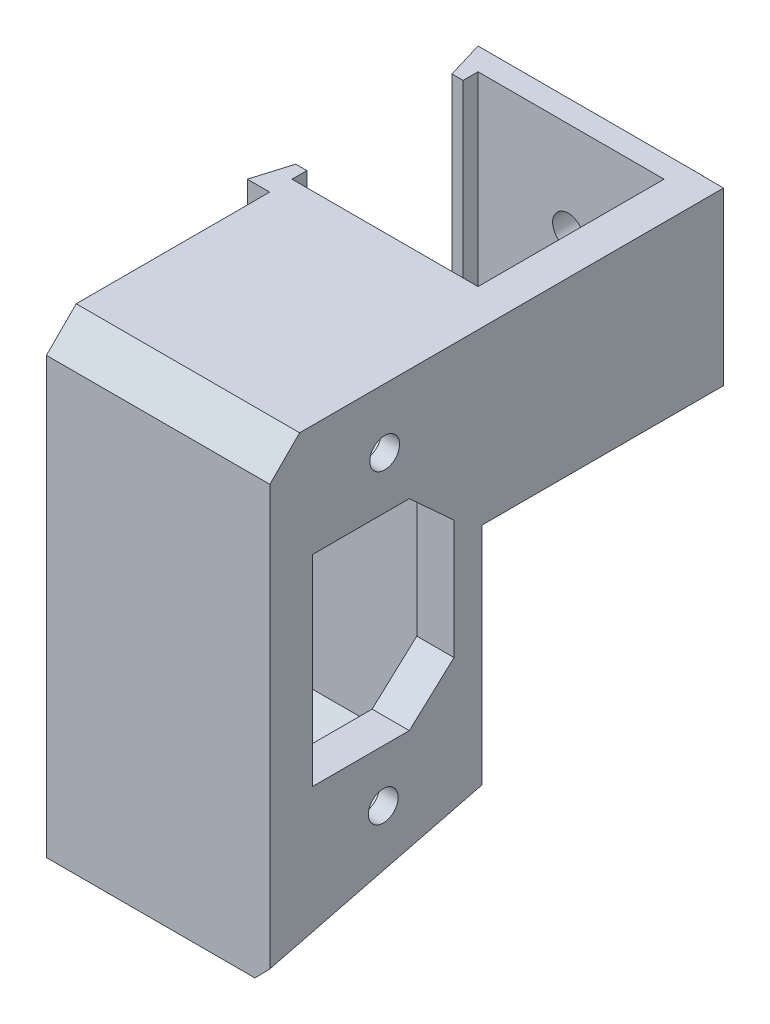
from build123d import *

# Parameters (mm, degrees)
EXTRUDE_1_DEPTH           = 110
CUT_EXTRUDE_4_DEPTH       = 134.373777696
SKETCH_7_W                = 16.60831278
SKETCH_7_H                = 38.473598513
CUT_EXTRUDE_14_DEPTH      = 134.373777696
SKETCH_8_W                = 5
SKETCH_8_H                = 30.968526609
EXTRUDE_2_DEPTH           = 110
SKETCH_10_W               = 5
SKETCH_10_H               = 26
EXTRUDE_4_DEPTH           = 110
SKETCH_16_W               = 45
SKETCH_16_H               = 4
EXTRUDE_7_DEPTH           = 110
SKETCH_18_W               = 113.67218818
SKETCH_18_H               = 61.649849458
CUT_EXTRUDE_18_DEPTH      = 137.586229955
SKETCH_19_R               = 2.1
SKETCH_19_R_2             = 2
CUT_EXTRUDE_19_DEPTH      = 143.431323365
SKETCH_22_W               = 25
SKETCH_22_H               = 3
EXTRUDE_10_DEPTH          = 50
SKETCH_23_R               = 2
CUT_EXTRUDE_24_DEPTH      = 10
CUT_EXTRUDE_25_DEPTH      = 138.145152867
CUT_EXTRUDE_25_DEPTH_BACK = 138.145152867
SKETCH_24_W               = 94.85705968
SKETCH_24_H               = 31.336652995
SKETCH_24_W_2             = 96.91469655
SKETCH_24_H_2             = 33.70168341
SKETCH_26_W               = 42.056158723
SKETCH_26_H               = 66.577758737
CUT_EXTRUDE_26_DEPTH      = 85.230722286
EXTRUDE_11_DEPTH          = 5
SKETCH_28_R               = 2
SKETCH_28_W               = 19
SKETCH_28_H               = 27
CUT_EXTRUDE_27_DEPTH      = 109.719377855
EXTRUDE_13_DEPTH          = 5
EXTRUDE_14_DEPTH          = 25.02681365
EXTRUDE_15_DEPTH          = 25.02681365
CHAMFER_1_SIZE            = 4
CHAMFER_2_SIZE            = 3
CUT_EXTRUDE_28_DEPTH      = 2.5
CHAMFER_3_SIZE            = 2
CHAMFER_4_SIZE            = 2


with BuildPart() as part:
    # Эскиз1 → Бобышка-Вытянуть1 (new body)
    with BuildSketch(Plane(origin=(0, 0, 0), x_dir=(1, 0, 0), z_dir=(0, 1, 0))):
        Polygon((-66.825757576, 34.969739794), (-66.825757576, 29.969739794), (-63.825757576, 29.969739794), (-63.825757576, 31.969739794), (-38.825757576, 31.969739794), (-38.825757576, 6.969739794), (-63.825757576, 6.969739794), (-63.825757576, 8.969739794), (-66.825757576, 8.969739794), (-66.825757576, 3.969739794), (-22.123470102, 3.969739794), (-36.579007505, 34.969739794), align=None)
    extrude(amount=EXTRUDE_1_DEPTH)

    # Эскиз3 → Вырез-Вытянуть4 (cut, through all)
    with BuildSketch(Plane.XZ):
        Polygon((-66.825757576, -3.969739794), (-65.325757576, -8.969739794), (-66.825757576, -8.969739794), align=None)
        Polygon((-66.825757576, -29.969739794), (-66.825757576, -34.969739794), (-65.325757576, -29.969739794), align=None)
    extrude(amount=-CUT_EXTRUDE_4_DEPTH, mode=Mode.SUBTRACT)

    # Эскиз7 → Вырез-Вытянуть14 (cut, through all)
    with BuildSketch(Plane(origin=(0, 0, 0), x_dir=(-1, 0, 0), z_dir=(0, -1, 0))):
        with Locations((27.703474463, 20.539743139)):
            Rectangle(SKETCH_7_W, SKETCH_7_H)
    extrude(amount=-CUT_EXTRUDE_14_DEPTH, mode=Mode.SUBTRACT)

    # Эскиз8 → Бобышка-Вытянуть2 (add)
    with BuildSketch(Plane(origin=(0, 0, 0), x_dir=(-1, 0, 0), z_dir=(0, -1, 0))):
        with Locations((36.298943925, 19.454003098)):
            Rectangle(SKETCH_8_W, SKETCH_8_H)
    extrude(amount=-EXTRUDE_2_DEPTH)

    # Эскиз10 → Бобышка-Вытянуть4 (add)
    with BuildSketch(Plane.XZ):
        with Locations((-36.298943925, 9.030260206)):
            Rectangle(SKETCH_10_W, SKETCH_10_H)
    extrude(amount=-EXTRUDE_4_DEPTH)

    # Эскиз16 → Бобышка-Вытянуть7 (add, through all)
    with BuildSketch(Plane(origin=(0, 110, 0), x_dir=(1, 0, 0), z_dir=(0, 1, 0))):
        with Locations((-16.298943925, -24.030260206)):
            Rectangle(SKETCH_16_W, SKETCH_16_H)
    extrude(amount=-EXTRUDE_7_DEPTH)

    # Эскиз18 → Вырез-Вытянуть18 (cut, through all)
    with BuildSketch(Plane(origin=(6.201056075, 0, 0), x_dir=(0, 0, -1), z_dir=(1, 0, 0))):
        with Locations((3.709673157, 29.175075271)):
            Rectangle(SKETCH_18_W, SKETCH_18_H)
    extrude(amount=-CUT_EXTRUDE_18_DEPTH, mode=Mode.SUBTRACT)

    # Эскиз19 → Вырез-Вытянуть19 (cut, through all)
    with BuildSketch(Plane(origin=(0, 0, -34.969739794), x_dir=(-1, 0, 0), z_dir=(0, 0, -1))):
        with Locations((51.70238254, 85)):
            Circle(SKETCH_19_R)
        with Locations((3.798943925, 85)):
            Circle(SKETCH_19_R_2)
    extrude(amount=-CUT_EXTRUDE_19_DEPTH, mode=Mode.SUBTRACT)

    # Эскиз22 → Бобышка-Вытянуть10 (add)
    with BuildSketch(Plane.XZ.offset(-60)):
        with Locations((-21.298943925, -30.469739794)):
            Rectangle(SKETCH_22_W, SKETCH_22_H)
    extrude(amount=-EXTRUDE_10_DEPTH)

    # Эскиз23 → Вырез-Вытянуть24 (cut)
    with BuildSketch(Plane(origin=(0, 0, -31.969739794), x_dir=(-1, 0, 0), z_dir=(0, 0, -1))):
        with Locations((21.298943925, 85)):
            Circle(SKETCH_23_R)
    extrude(amount=-CUT_EXTRUDE_24_DEPTH, mode=Mode.SUBTRACT)

    # Эскиз24 → Вырез-Вытянуть25 (cut, two sides: drawn at the far end of the back side and taken through both)
    with BuildSketch(Plane(origin=(-62.400623407, 0, -18.720187022), x_dir=(-0.2873478855663458, 0, 0.9578262852211513), z_dir=(-0.9578262852211514, 0, -0.2873478855663458)).offset(-CUT_EXTRUDE_25_DEPTH_BACK)):
        with Locations((8.655390038, 113.168326498)):
            Rectangle(SKETCH_24_W, SKETCH_24_H)
        with Locations((7.626571603, 55.649158295)):
            Rectangle(SKETCH_24_W_2, SKETCH_24_H_2)
    extrude(amount=CUT_EXTRUDE_25_DEPTH + CUT_EXTRUDE_25_DEPTH_BACK, mode=Mode.SUBTRACT)

    # Эскиз26 → Вырез-Вытянуть26 (cut, through all)
    with BuildSketch(Plane.XZ.offset(-60)):
        with Locations((-12.770864564, -1.649387034)):
            Rectangle(SKETCH_26_W, SKETCH_26_H)
    extrude(amount=-CUT_EXTRUDE_26_DEPTH, mode=Mode.SUBTRACT)

    # Эскиз27 → Бобышка-Вытянуть11 (add)
    with BuildSketch(Plane(origin=(-33.798943925, 0, 0), x_dir=(0, 0, -1), z_dir=(1, 0, 0))):
        Polygon((-26.030260206, 72.5), (4.449739794, 72.5), (4.449739794, 42.7), (-26.030260206, 35.043953179), align=None)
    extrude(amount=-EXTRUDE_11_DEPTH)

    # Эскиз28 → Вырез-Вытянуть27 (cut, through all)
    with BuildSketch(Plane(origin=(-33.798943925, 0, 0), x_dir=(0, 0, -1), z_dir=(1, 0, 0))):
        with Locations((-10.603567011, 89.464970071)):
            Circle(SKETCH_28_R)
        with Locations((-10.790260206, 48.464970071)):
            Circle(SKETCH_28_R)
        with Locations((-10.790260206, 68.964970071)):
            Rectangle(SKETCH_28_W, SKETCH_28_H)
    extrude(amount=-CUT_EXTRUDE_27_DEPTH, mode=Mode.SUBTRACT)

    # Эскиз29 → Бобышка-Вытянуть13 (add)
    with BuildSketch(Plane(origin=(-33.798943925, 0, 0), x_dir=(0, 0, -1), z_dir=(1, 0, 0))):
        Polygon((-7.290260206, 82.464970071), (-1.290260206, 82.464970071), (-1.290260206, 76.964970071), align=None)
        Polygon((-1.290260206, 60.964970071), (-7.290260206, 55.464970071), (-1.290260206, 55.464970071), align=None)
    extrude(amount=-EXTRUDE_13_DEPTH)

    # Эскиз30 → Бобышка-Вытянуть14 (add)
    with BuildSketch(Plane.ZY.offset(38.798943925)):
        Polygon((-4.449739794, 42.7), (-4.449739794, 97.5), (-1.449739794, 97.5), (-1.449739794, 45.039643715), (26.030260206, 38.137144809), (26.030260206, 35.043953179), align=None)
    extrude(amount=EXTRUDE_14_DEPTH)

    # Эскиз32 → Бобышка-Вытянуть15 (add)
    with BuildSketch(Plane.ZY.offset(38.798943925)):
        Polygon((-1.449739794, 97.5), (26.030260206, 97.5), (26.030260206, 38.137144809), (24.030260206, 38.639510086), (24.030260206, 95.5), (-1.449739794, 95.5), align=None)
    extrude(amount=EXTRUDE_15_DEPTH)

    # Фаска1
    chamfer_1_edges = [part.edges().sort_by_distance(p)[0] for p in [
        (-48.81235075, 97.5, 26.030260206),
    ]]
    chamfer(chamfer_1_edges, length=CHAMFER_1_SIZE - 0.0001)  # a hair under: the kernel refuses the full size

    # Фаска2
    chamfer_2_edges = [part.edges().sort_by_distance(p)[0] for p in [
        (-51.31235075, 95.5, 24.030260206),
    ]]
    chamfer(chamfer_2_edges, length=CHAMFER_2_SIZE)

    # Эскиз33 → Вырез-Вытянуть28 (cut)
    with BuildSketch(Plane.ZY.offset(38.798943925)):
        Polygon((10.603567011, 93.506421955), (7.103567011, 91.485696013), (7.103567011, 87.444244129), (10.603567011, 85.423518186), (14.103567011, 87.444244129), (14.103567011, 91.485696013), align=None)
        Polygon((10.790260206, 52.506421955), (7.290260206, 50.485696013), (7.290260206, 46.444244129), (10.790260206, 44.423518186), (14.290260206, 46.444244129), (14.290260206, 50.485696013), align=None)
    extrude(amount=-CUT_EXTRUDE_28_DEPTH, mode=Mode.SUBTRACT)

    # Фаска3
    chamfer_3_edges = [part.edges().sort_by_distance(p)[0] for p in [
        (-33.798943925, 72.5, -19.694003099),
        (-33.798943925, 57.6, -4.449739794),
    ]]
    chamfer(chamfer_3_edges, length=CHAMFER_3_SIZE)

    # Фаска4
    chamfer_4_edges = [part.edges().sort_by_distance(p)[0] for p in [
        (-33.798943925, 38.620793951, 11.790260206),
    ]]
    chamfer(chamfer_4_edges, length=CHAMFER_4_SIZE)


solid = part.part
